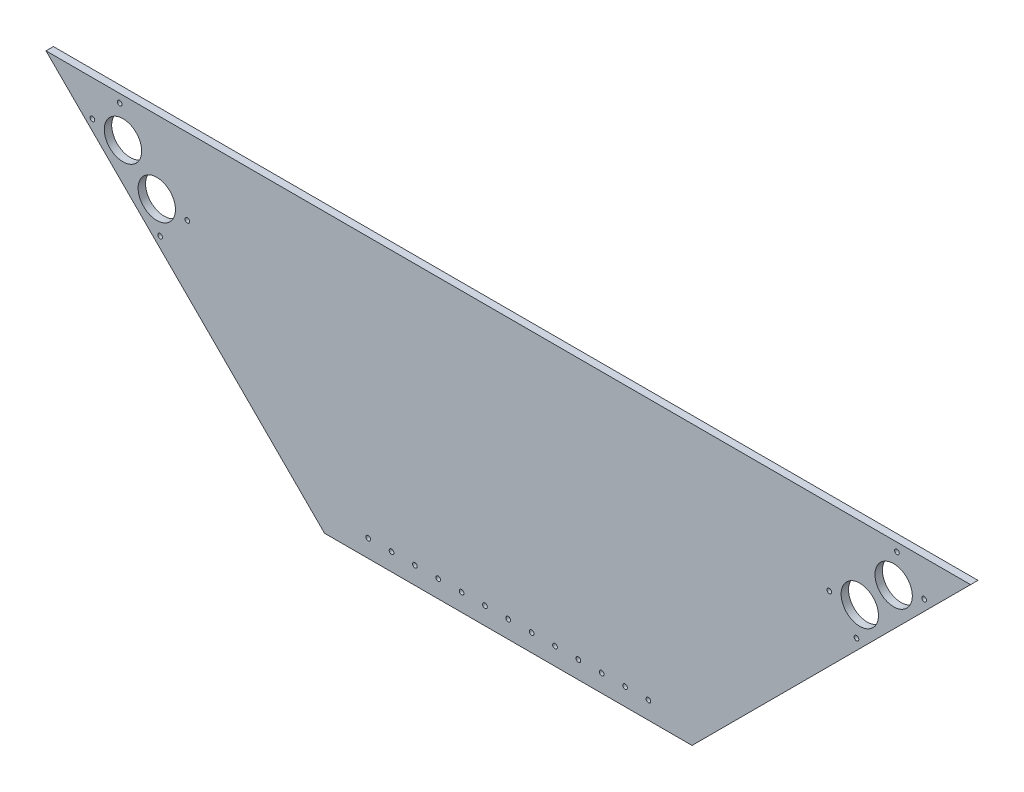
from build123d import *

# Parameters (mm, degrees)
BOSS_EXTRUDE1_DEPTH    = 3.175
POLE_MOUNTING_HOLES_R  = 1
CUT_EXTRUDE1_DEPTH     = 232.144846903
ROTATED_ULTRASONIC_R   = 8
ROTATED_ULTRASONIC_R_2 = 1
CUT_EXTRUDE2_DEPTH     = 232.144846903


with BuildPart() as part:
    # Sketch1 → Boss-Extrude1 (new body)
    with BuildSketch(Plane.XY):
        Polygon((-197.965, 119.28), (197.965, 119.28), (78.685, 0), (-78.685, 0), align=None)
    extrude(amount=BOSS_EXTRUDE1_DEPTH)

    # Pole Mounting Holes → Cut-Extrude1 (cut, through all)
    with BuildSketch(Plane.XY.offset(3.175)):
        with Locations((0, 7.5)):
            Circle(POLE_MOUNTING_HOLES_R)
        with Locations((10, 7.5)):
            Circle(POLE_MOUNTING_HOLES_R)
        with Locations((20, 7.5)):
            Circle(POLE_MOUNTING_HOLES_R)
        with Locations((30, 7.5)):
            Circle(POLE_MOUNTING_HOLES_R)
        with Locations((40, 7.5)):
            Circle(POLE_MOUNTING_HOLES_R)
        with Locations((50, 7.5)):
            Circle(POLE_MOUNTING_HOLES_R)
        with Locations((60, 7.5)):
            Circle(POLE_MOUNTING_HOLES_R)
        with Locations((-10, 7.5)):
            Circle(POLE_MOUNTING_HOLES_R)
        with Locations((-20, 7.5)):
            Circle(POLE_MOUNTING_HOLES_R)
        with Locations((-30, 7.5)):
            Circle(POLE_MOUNTING_HOLES_R)
        with Locations((-40, 7.5)):
            Circle(POLE_MOUNTING_HOLES_R)
        with Locations((-50, 7.5)):
            Circle(POLE_MOUNTING_HOLES_R)
        with Locations((-60, 7.5)):
            Circle(POLE_MOUNTING_HOLES_R)
    extrude(amount=-CUT_EXTRUDE1_DEPTH, mode=Mode.SUBTRACT)

    # Rotated Ultrasonic → Cut-Extrude2 (cut, through all)
    with BuildSketch(Plane.XY.offset(3.175)):
        with Locations((-165.014760324, 102.589016593)):
            Circle(ROTATED_ULTRASONIC_R)
        with Locations((-178.096235776, 104.003230156)):
            Circle(ROTATED_ULTRASONIC_R_2)
        with Locations((-166.428973886, 115.670492045)):
            Circle(ROTATED_ULTRASONIC_R_2)
        with Locations((-137.437595858, 86.679114017)):
            Circle(ROTATED_ULTRASONIC_R_2)
        with Locations((-149.104857747, 75.011852127)):
            Circle(ROTATED_ULTRASONIC_R_2)
        with Locations((-150.51907131, 88.093327579)):
            Circle(ROTATED_ULTRASONIC_R)
    cut_extrude2 = extrude(amount=-CUT_EXTRUDE2_DEPTH, mode=Mode.SUBTRACT)

    # Mirror1: Cut-Extrude2 across plane
    add(cut_extrude2.mirror(Plane(origin=(0, 0, 0), x_dir=(0, 0, 1), z_dir=(1, 0, 0))), mode=Mode.SUBTRACT)


solid = part.part
